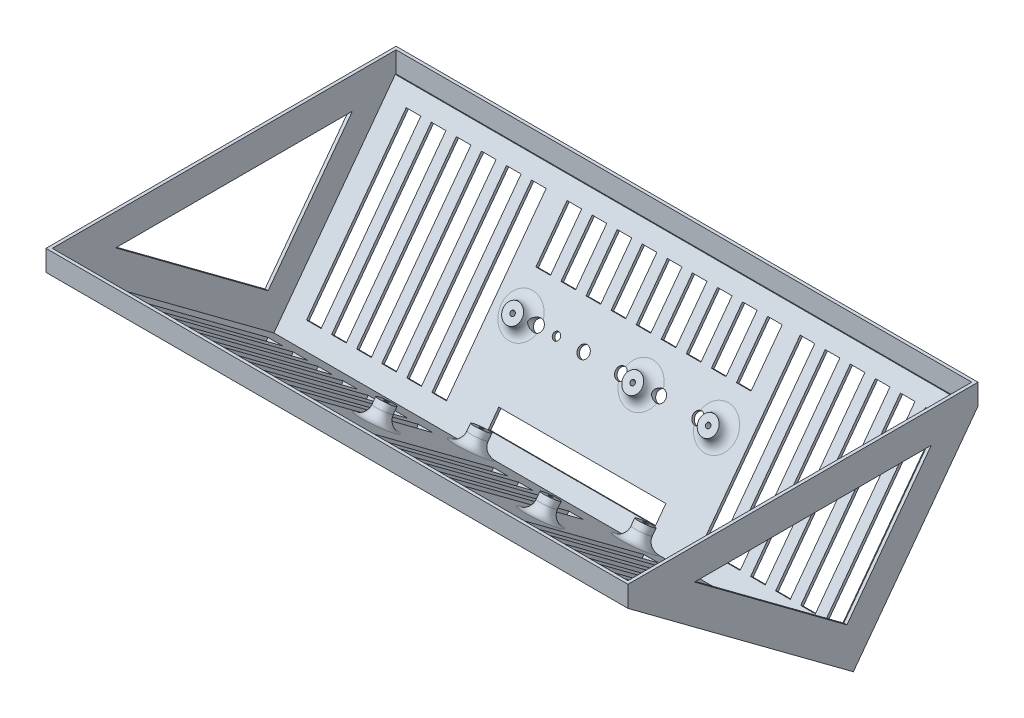
from build123d import *

# Parameters (mm, degrees)
SKETCH1_W           = 278.6
SKETCH1_H           = 167.6
SKETCH1_W_2         = 275.6
SKETCH1_H_2         = 164.6
BOSS_EXTRUDE2_DEPTH = 10
BOSS_EXTRUDE3_DEPTH = 1.5
BOSS_EXTRUDE4_DEPTH = 277.1
BOSS_EXTRUDE5_DEPTH = 1.5
SKETCH5_R           = 4
BOSS_EXTRUDE6_DEPTH = 8
FILLET1_R           = 5
SKETCH7_W           = 80
SKETCH7_H           = 8.5
CUT_EXTRUDE1_DEPTH  = 8
SKETCH8_R           = 4.5
BOSS_EXTRUDE7_DEPTH = 5
SKETCH9_R           = 2.75
SKETCH9_R_2         = 1.75
CUT_EXTRUDE2_DEPTH  = 337.415307484
FILLET2_R           = 5
SKETCH10_R          = 1.1
CUT_EXTRUDE3_DEPTH  = 5
SKETCH11_R          = 1.15
CUT_EXTRUDE4_DEPTH  = 4
SKETCH12_W          = 7
SKETCH12_H          = 80
CUT_EXTRUDE5_DEPTH  = 337.415307484
SKETCH13_W          = 7
SKETCH13_H          = 25
CUT_EXTRUDE6_DEPTH  = 5
SKETCH14_W          = 7
SKETCH14_H          = 100
CUT_EXTRUDE7_DEPTH  = 5
CUT_EXTRUDE10_DEPTH = 336.738898941


with BuildPart() as part:
    # Sketch1 → Boss-Extrude2 (new body)
    with BuildSketch(Plane(origin=(0, 0, 0), x_dir=(1, 0, 0), z_dir=(0, 1, 0))):
        with Locations((141, -85.5)):
            Rectangle(SKETCH1_W, SKETCH1_H)
        with Locations((141, -85.5)):
            Rectangle(SKETCH1_W_2, SKETCH1_H_2, mode=Mode.SUBTRACT)
    extrude(amount=BOSS_EXTRUDE2_DEPTH)

    # Sketch2 → Boss-Extrude3 (add)
    with BuildSketch(Plane(origin=(280.3, 0, 0), x_dir=(0, 0, -1), z_dir=(1, 0, 0))):
        Polygon((-1.7, 0), (-61.364409308, -80.250596645), (-169.3, 0), align=None)
    extrude(amount=-BOSS_EXTRUDE3_DEPTH)

    # Sketch3 → Boss-Extrude4 (add)
    with BuildSketch(Plane.ZY.offset(-278.8)):
        Polygon((61.364409308, -80.250596645), (1.7, 0), (3.566900424, 0), (61.673163888, -78.151865932), (166.786, 0), (169.3, 0), (62.568151955, -79.355608579), align=None)
    extrude(amount=BOSS_EXTRUDE4_DEPTH)

    # Sketch4 → Boss-Extrude5 (add)
    with BuildSketch(Plane.ZY.offset(-1.7)):
        Polygon((61.673163888, -78.151865932), (3.566900424, 0), (166.786, 0), align=None)
    extrude(amount=-BOSS_EXTRUDE5_DEPTH)

    # Sketch5 → Boss-Extrude6 (add)
    with BuildSketch(Plane(origin=(0, -79.859753822, 59.376085785), x_dir=(1, 0, 0), z_dir=(0, 0.8024950980827069, -0.5966587111181958))):
        with Locations(Location((101.7, -7.862420105, 0), (0, 0, 90))):
            Circle(SKETCH5_R)
        with Locations(Location((180.3, -7.862420105, 0), (0, 0, 90))):
            Circle(SKETCH5_R)
        with Locations(Location((101.7, -64.462420105, 0), (0, 0, 90))):
            Circle(SKETCH5_R)
        with Locations(Location((180.3, -64.462420105, 0), (0, 0, 90))):
            Circle(SKETCH5_R)
    extrude(amount=BOSS_EXTRUDE6_DEPTH)

    # Fillet1
    # the kernel refuses this fillet: 5 mm, written as the material it adds along each edge
    with BuildSketch(Plane(origin=(101.7, -75.168572376, 65.685639379), x_dir=(0, -0.596658711118196, -0.8024950980827068), z_dir=(1, 0, 0))) as fillet1_piece_1_section:
        with BuildLine():
            CenterArc((4 + FILLET1_R, FILLET1_R), FILLET1_R, 180, 90)
            Line((4, FILLET1_R), (4, 0))
            Line((4, 0), (4 + FILLET1_R, 0))
        make_face()
    fillet1_piece_1 = revolve(axis=Axis((101.7, -75.168572376, 65.685639379), (0, 0.8024950980827069, -0.5966587111181958)), mode=Mode.PRIVATE)
    fillet1_piece_1 = split(fillet1_piece_1, bisect_by=Plane(origin=(101.7, -77.007253613, 60.822139486), z_dir=(0, 0.5966587111181958, 0.8024950980827069)), keep=Keep.TOP, mode=Mode.PRIVATE)
    add(fillet1_piece_1)
    with BuildSketch(Plane(origin=(180.3, -75.168572376, 65.685639379), x_dir=(0, -0.5966587111181954, -0.8024950980827071), z_dir=(1, 0, 0))) as fillet1_piece_2_section:
        with BuildLine():
            CenterArc((4 + FILLET1_R, FILLET1_R), FILLET1_R, 180, 90)
            Line((4, FILLET1_R), (4, 0))
            Line((4, 0), (4 + FILLET1_R, 0))
        make_face()
    fillet1_piece_2 = revolve(axis=Axis((180.3, -75.168572376, 65.685639379), (0, 0.8024950980827069, -0.5966587111181958)), mode=Mode.PRIVATE)
    fillet1_piece_2 = split(fillet1_piece_2, bisect_by=Plane(origin=(180.3, -77.007253613, 60.822139486), z_dir=(0, 0.5966587111181958, 0.8024950980827069)), keep=Keep.TOP, mode=Mode.PRIVATE)
    add(fillet1_piece_2)
    with BuildSketch(Plane(origin=(101.7, -41.397689327, 111.10686193), x_dir=(0, -0.5966587111181957, -0.802495098082707), z_dir=(1, 0, 0))) as fillet1_piece_3:
        with BuildLine():
            CenterArc((4 + FILLET1_R, FILLET1_R), FILLET1_R, 180, 90)
            Line((4, FILLET1_R), (4, 0))
            Line((4, 0), (4 + FILLET1_R, 0))
        make_face()
    revolve(axis=Axis((101.7, -41.397689327, 111.10686193), (0, 0.8024950980827069, -0.5966587111181958)))
    with BuildSketch(Plane(origin=(180.3, -41.397689327, 111.10686193), x_dir=(0, -0.5966587111181951, -0.8024950980827075), z_dir=(1, 0, 0))) as fillet1_piece_4:
        with BuildLine():
            CenterArc((4 + FILLET1_R, FILLET1_R), FILLET1_R, 180, 90)
            Line((4, FILLET1_R), (4, 0))
            Line((4, 0), (4 + FILLET1_R, 0))
        make_face()
    revolve(axis=Axis((180.3, -41.397689327, 111.10686193), (0, 0.8024950980827069, -0.5966587111181958)))

    # Sketch7 → Cut-Extrude1 (cut)
    with BuildSketch(Plane(origin=(0, 1.707887891, 2.297078103), x_dir=(1, 0, 0), z_dir=(0, 0.5966587111181957, 0.8024950980827071))):
        with Locations((141, -87.264319792)):
            Rectangle(SKETCH7_W, SKETCH7_H)
    extrude(amount=-CUT_EXTRUDE1_DEPTH, mode=Mode.SUBTRACT)

    # Sketch8 → Boss-Extrude7 (add)
    with BuildSketch(Plane(origin=(0, 1.707887891, 2.297078103), x_dir=(1, 0, 0), z_dir=(0, 0.5966587111181957, 0.8024950980827071))):
        with Locations(Location((93.2, -52.12822221, 0), (0, 0, 90))):
            Circle(SKETCH8_R)
        with Locations(Location((150.7, -52.12822221, 0), (0, 0, 90))):
            Circle(SKETCH8_R)
        with Locations(Location((186.7, -51.909307876, 0), (0, 0, 90))):
            Circle(SKETCH8_R)
    extrude(amount=BOSS_EXTRUDE7_DEPTH)

    # Sketch9 → Cut-Extrude2 (cut, through all)
    with BuildSketch(Plane(origin=(0, 1.707887891, 2.297078103), x_dir=(1, 0, 0), z_dir=(0, 0.5966587111181957, 0.8024950980827071))):
        with Locations(Location((101.2, -52.12822221, 0), (0, 0, 270))):
            Circle(SKETCH9_R)
        with Locations(Location((110.2, -52.12822221, 0), (0, 0, 270))):
            Circle(SKETCH9_R_2)
        with Locations(Location((123.2, -52.12822221, 0), (0, 0, 270))):
            Circle(SKETCH9_R)
        with Locations(Location((141.2, -52.12822221, 0), (0, 0, 270))):
            Circle(SKETCH9_R)
        with Locations(Location((159.7, -52.12822221, 0), (0, 0, 270))):
            Circle(SKETCH9_R)
        with Locations(Location((178.2, -52.12822221, 0), (0, 0, 270))):
            Circle(SKETCH9_R)
    extrude(amount=-CUT_EXTRUDE2_DEPTH, mode=Mode.SUBTRACT)

    # Fillet2
    # the kernel refuses this fillet: 5 mm, written as the material it adds along each edge
    with BuildSketch(Plane(origin=(93.2, -40.124754904, 33.39983598), x_dir=(0, 0.8024950980827078, -0.5966587111181948), z_dir=(1, 0, 0))) as fillet2_piece_1_section:
        with BuildLine():
            CenterArc((4.5 + FILLET2_R, FILLET2_R), FILLET2_R, 180, 90)
            Line((4.5, FILLET2_R), (4.5, 0))
            Line((4.5, 0), (4.5 + FILLET2_R, 0))
        make_face()
    fillet2_piece_1 = revolve(axis=Axis((93.2, -40.124754904, 33.39983598), (0, 0.5966587111181957, 0.8024950980827071)), mode=Mode.PRIVATE)
    fillet2_piece_1 = fillet2_piece_1 - Plane(origin=(101.2, -39.276196691, 34.54113132), x_dir=(0, -0.8024950980827071, 0.5966587111181957), z_dir=(0, 0.5966587111181957, 0.8024950980827071)) * Cylinder(2.75, 39, mode=Mode.PRIVATE)
    add(fillet2_piece_1)
    with BuildSketch(Plane(origin=(150.7, -40.124754904, 33.39983598), x_dir=(0, 0.8024950980827078, -0.5966587111181947), z_dir=(1, 0, 0))) as fillet2_piece_2_section:
        with BuildLine():
            CenterArc((4.5 + FILLET2_R, FILLET2_R), FILLET2_R, 180, 90)
            Line((4.5, FILLET2_R), (4.5, 0))
            Line((4.5, 0), (4.5 + FILLET2_R, 0))
        make_face()
    fillet2_piece_2 = revolve(axis=Axis((150.7, -40.124754904, 33.39983598), (0, 0.5966587111181957, 0.8024950980827071)), mode=Mode.PRIVATE)
    fillet2_piece_2 = fillet2_piece_2 - Plane(origin=(141.2, -39.276329841, 34.540952235), x_dir=(0, -0.8024950980827071, 0.5966587111181957), z_dir=(0, 0.5966587111181957, 0.8024950980827071)) * Cylinder(2.75, 38, mode=Mode.PRIVATE)
    fillet2_piece_2 = fillet2_piece_2 - Plane(origin=(159.7, -39.276329841, 34.540952235), x_dir=(0, -0.8024950980827071, 0.5966587111181957), z_dir=(0, 0.5966587111181957, 0.8024950980827071)) * Cylinder(2.75, 38, mode=Mode.PRIVATE)
    add(fillet2_piece_2)
    with BuildSketch(Plane(origin=(186.7, -39.949077224, 33.269218835), x_dir=(0, 0.802495098082707, -0.5966587111181957), z_dir=(1, 0, 0))) as fillet2_piece_3_section:
        with BuildLine():
            CenterArc((4.5 + FILLET2_R, FILLET2_R), FILLET2_R, 180, 90)
            Line((4.5, FILLET2_R), (4.5, 0))
            Line((4.5, 0), (4.5 + FILLET2_R, 0))
        make_face()
    fillet2_piece_3 = revolve(axis=Axis((186.7, -39.949077224, 33.269218835), (0, 0.5966587111181957, 0.8024950980827071)), mode=Mode.PRIVATE)
    fillet2_piece_3 = fillet2_piece_3 - Plane(origin=(178.2, -39.276347723, 34.540928185), x_dir=(0, -0.8024950980827071, 0.5966587111181957), z_dir=(0, 0.5966587111181957, 0.8024950980827071)) * Cylinder(2.75, 38, mode=Mode.PRIVATE)
    add(fillet2_piece_3)

    # Sketch10 → Cut-Extrude3 (cut)
    with BuildSketch(Plane(origin=(0, -73.439793038, 54.602816096), x_dir=(1, 0, 0), z_dir=(0, 0.8024950980827069, -0.5966587111181958))):
        with Locations(Location((101.7, -64.462420105, 0), (0, 0, 270))):
            Circle(SKETCH10_R)
        with Locations(Location((180.3, -64.462420105, 0), (0, 0, 270))):
            Circle(SKETCH10_R)
        with Locations(Location((180.3, -7.862420105, 0), (0, 0, 270))):
            Circle(SKETCH10_R)
        with Locations(Location((101.7, -7.862420105, 0), (0, 0, 270))):
            Circle(SKETCH10_R)
    extrude(amount=-CUT_EXTRUDE3_DEPTH, mode=Mode.SUBTRACT)

    # Sketch11 → Cut-Extrude4 (cut)
    with BuildSketch(Plane(origin=(0, 4.691181446, 6.309553594), x_dir=(1, 0, 0), z_dir=(0, 0.5966587111181958, 0.8024950980827069))):
        with Locations(Location((93.2, -52.12822221, 0), (0, 0, 270))):
            Circle(SKETCH11_R)
        with Locations(Location((150.7, -52.12822221, 0), (0, 0, 270))):
            Circle(SKETCH11_R)
        with Locations(Location((186.7, -51.909307876, 0), (0, 0, 270))):
            Circle(SKETCH11_R)
    extrude(amount=-CUT_EXTRUDE4_DEPTH, mode=Mode.SUBTRACT)

    # Sketch12 → Cut-Extrude5 (cut, through all)
    with BuildSketch(Plane(origin=(0, 1.707887891, 2.297078103), x_dir=(1, 0, 0), z_dir=(0, 0.5966587111181957, 0.8024950980827071))):
        with Locations((28.7, -50.12822221)):
            Rectangle(SKETCH12_W, SKETCH12_H)
        with Locations((16.7, -50.12822221)):
            Rectangle(SKETCH12_W, SKETCH12_H)
        with Locations((40.7, -50.12822221)):
            Rectangle(SKETCH12_W, SKETCH12_H)
        with Locations((52.7, -50.12822221)):
            Rectangle(SKETCH12_W, SKETCH12_H)
        with Locations((64.7, -50.12822221)):
            Rectangle(SKETCH12_W, SKETCH12_H)
        with Locations((76.7, -50.12822221)):
            Rectangle(SKETCH12_W, SKETCH12_H)
        with Locations((265.3, -50.12822221)):
            Rectangle(SKETCH12_W, SKETCH12_H)
        with Locations((253.3, -50.12822221)):
            Rectangle(SKETCH12_W, SKETCH12_H)
        with Locations((241.3, -50.12822221)):
            Rectangle(SKETCH12_W, SKETCH12_H)
        with Locations((229.3, -50.12822221)):
            Rectangle(SKETCH12_W, SKETCH12_H)
        with Locations((217.3, -50.12822221)):
            Rectangle(SKETCH12_W, SKETCH12_H)
        with Locations((205.3, -50.12822221)):
            Rectangle(SKETCH12_W, SKETCH12_H)
    extrude(amount=-CUT_EXTRUDE5_DEPTH, mode=Mode.SUBTRACT)

    # Sketch13 → Cut-Extrude6 (cut)
    with BuildSketch(Plane(origin=(0, 1.707887891, 2.297078103), x_dir=(1, 0, 0), z_dir=(0, 0.5966587111181957, 0.8024950980827071))):
        with Locations((105.7, -22.62822221)):
            Rectangle(SKETCH13_W, SKETCH13_H)
        with Locations((93.7, -22.62822221)):
            Rectangle(SKETCH13_W, SKETCH13_H)
        with Locations((117.7, -22.62822221)):
            Rectangle(SKETCH13_W, SKETCH13_H)
        with Locations((129.7, -22.62822221)):
            Rectangle(SKETCH13_W, SKETCH13_H)
        with Locations((141.7, -22.62822221)):
            Rectangle(SKETCH13_W, SKETCH13_H)
        with Locations((153.7, -22.62822221)):
            Rectangle(SKETCH13_W, SKETCH13_H)
        with Locations((165.7, -22.62822221)):
            Rectangle(SKETCH13_W, SKETCH13_H)
        with Locations((177.7, -22.62822221)):
            Rectangle(SKETCH13_W, SKETCH13_H)
        with Locations((189.7, -22.62822221)):
            Rectangle(SKETCH13_W, SKETCH13_H)
    extrude(amount=-CUT_EXTRUDE6_DEPTH, mode=Mode.SUBTRACT)

    # Sketch14 → Cut-Extrude7 (cut)
    with BuildSketch(Plane(origin=(0, -79.859753822, 59.376085785), x_dir=(1, 0, 0), z_dir=(0, 0.8024950980827069, -0.5966587111181958))):
        with Locations((16.7, -68.844947428)):
            Rectangle(SKETCH14_W, SKETCH14_H)
        with Locations((28.7, -68.844947428)):
            Rectangle(SKETCH14_W, SKETCH14_H)
        with Locations((40.7, -68.844947428)):
            Rectangle(SKETCH14_W, SKETCH14_H)
        with Locations((52.7, -68.844947428)):
            Rectangle(SKETCH14_W, SKETCH14_H)
        with Locations((64.7, -68.844947428)):
            Rectangle(SKETCH14_W, SKETCH14_H)
        with Locations((76.7, -68.844947428)):
            Rectangle(SKETCH14_W, SKETCH14_H)
        with Locations((88.7, -68.844947428)):
            Rectangle(SKETCH14_W, SKETCH14_H)
        with Locations((124.7, -68.844947428)):
            Rectangle(SKETCH14_W, SKETCH14_H)
        with Locations((136.7, -68.844947428)):
            Rectangle(SKETCH14_W, SKETCH14_H)
        with Locations((148.7, -68.844947428)):
            Rectangle(SKETCH14_W, SKETCH14_H)
        with Locations((160.7, -68.844947428)):
            Rectangle(SKETCH14_W, SKETCH14_H)
        with Locations((196.7, -68.844947428)):
            Rectangle(SKETCH14_W, SKETCH14_H)
        with Locations((208.7, -68.844947428)):
            Rectangle(SKETCH14_W, SKETCH14_H)
        with Locations((220.7, -68.844947428)):
            Rectangle(SKETCH14_W, SKETCH14_H)
        with Locations((232.7, -68.844947428)):
            Rectangle(SKETCH14_W, SKETCH14_H)
        with Locations((244.7, -68.844947428)):
            Rectangle(SKETCH14_W, SKETCH14_H)
        with Locations((256.7, -68.844947428)):
            Rectangle(SKETCH14_W, SKETCH14_H)
        with Locations((268.7, -68.844947428)):
            Rectangle(SKETCH14_W, SKETCH14_H)
    extrude(amount=-CUT_EXTRUDE7_DEPTH, mode=Mode.SUBTRACT)

    # Sketch15 → Cut-Extrude10 (cut, through all)
    with BuildSketch(Plane(origin=(280.3, 0, 0), x_dir=(0, 0, -1), z_dir=(1, 0, 0))):
        Polygon((-24.108830859, -5), (-137.435091073, -5), (-64.452174383, -59.263126478), align=None)
    extrude(amount=-CUT_EXTRUDE10_DEPTH, mode=Mode.SUBTRACT)


solid = part.part
